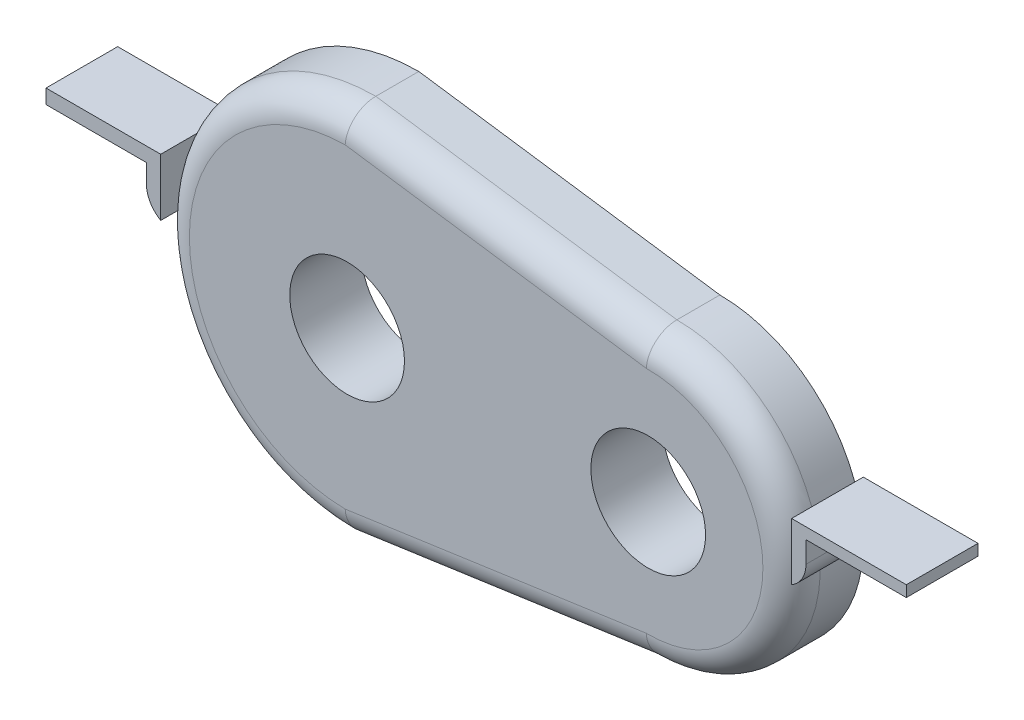
from build123d import *

# Parameters (mm, degrees)
SKETCH1_R           = 20
BOSS_EXTRUDE1_DEPTH = 25
FILLET1_R           = 10
BOSS_EXTRUDE2_DEPTH = 25
FILLET2_R           = 10
BOSS_EXTRUDE3_DEPTH = 25
FILLET3_R           = 10


with BuildPart() as part:
    # Sketch1 → Boss-Extrude1 (new body)
    with BuildSketch(Plane.XY):
        with BuildLine():
            Line((-61.96286897, 65), (43.03713103, 50))
            ThreePointArc((43.03713103, 50), (93.03713103, 0), (43.03713103, -50))
            Line((43.03713103, -50), (-61.96286897, -65))
            ThreePointArc((-61.96286897, -65), (-126.96286897, 0), (-61.96286897, 65))
        make_face()
        with Locations((43.03713103, 0)):
            Circle(SKETCH1_R, mode=Mode.SUBTRACT)
        with Locations((-61.96286897, 0)):
            Circle(SKETCH1_R, mode=Mode.SUBTRACT)
    extrude(amount=BOSS_EXTRUDE1_DEPTH)

    # Fillet1
    fillet1_edges = [part.edges().sort_by_distance(p)[0] for p in [
        (93.03713103, 0, 25),
        (-9.46286897, 57.5, 25),
        (-126.96286897, 0, 25),
        (-9.46286897, -57.5, 25),
    ]]
    fillet(fillet1_edges, radius=FILLET1_R)


with BuildPart() as body_2:
    # Sketch3 → Boss-Extrude2 (new body)
    with BuildSketch(Plane.XY.offset(25)):
        Polygon((93.03713103, 0), (93.03713103, 20), (133.03713103, 20), (133.03713103, 16.104825027), (98.03713103, 16.104825027), (98.03713103, 0), align=None)
    extrude(amount=-BOSS_EXTRUDE2_DEPTH)

    # Fillet2
    # the kernel refuses this fillet: 10 mm, written as the material it takes off along each edge
    with BuildSketch(Plane(origin=(98.03713103, 0, 46.650635095), x_dir=(0, 1, 0), z_dir=(0, 0, -1))) as fillet2_piece_1:
        with BuildLine():
            CenterArc((8.660254038, -10), FILLET2_R, 90, 60)
            Line((0, -5), (-0.173205081, -4.9))
            ThreePointArc((-0.173205081, -4.9), (-0.2, -2.5), (-0.2, 0))
            Line((-0.2, 0), (0, 0.2))
            Line((0, 0.2), (8.660254038, 0.2))
            Line((8.660254038, 0.2), (8.660254038, 0))
        make_face()
    extrude(amount=68.301270189, mode=Mode.SUBTRACT)


with BuildPart() as body_3:
    # Sketch4 → Boss-Extrude3 (new body)
    with BuildSketch(Plane.XY.offset(25)):
        Polygon((-126.96286897, 0), (-131.96286897, 0), (-131.96286897, 15), (-166.96286897, 15), (-166.96286897, 20), (-126.96286897, 20), align=None)
    extrude(amount=-BOSS_EXTRUDE3_DEPTH)

    # Fillet3
    # the kernel refuses this fillet: 10 mm, written as the material it takes off along each edge
    with BuildSketch(Plane(origin=(-131.96286897, 0, 46.650635095), x_dir=(1, 0, 0), z_dir=(0, 0, -1))) as fillet3_piece_1:
        with BuildLine():
            CenterArc((10, -8.660254038), FILLET3_R, 120, 60)
            Line((0, -8.660254038), (-0.2, -8.660254038))
            Line((-0.2, -8.660254038), (-0.2, 0))
            Line((-0.2, 0), (0, 0.2))
            ThreePointArc((0, 0.2), (2.5, 0.2), (4.9, 0.173205081))
            Line((4.9, 0.173205081), (5, 0))
        make_face()
    extrude(amount=68.301270189, mode=Mode.SUBTRACT)


solid = Compound([part.part, body_2.part, body_3.part])
